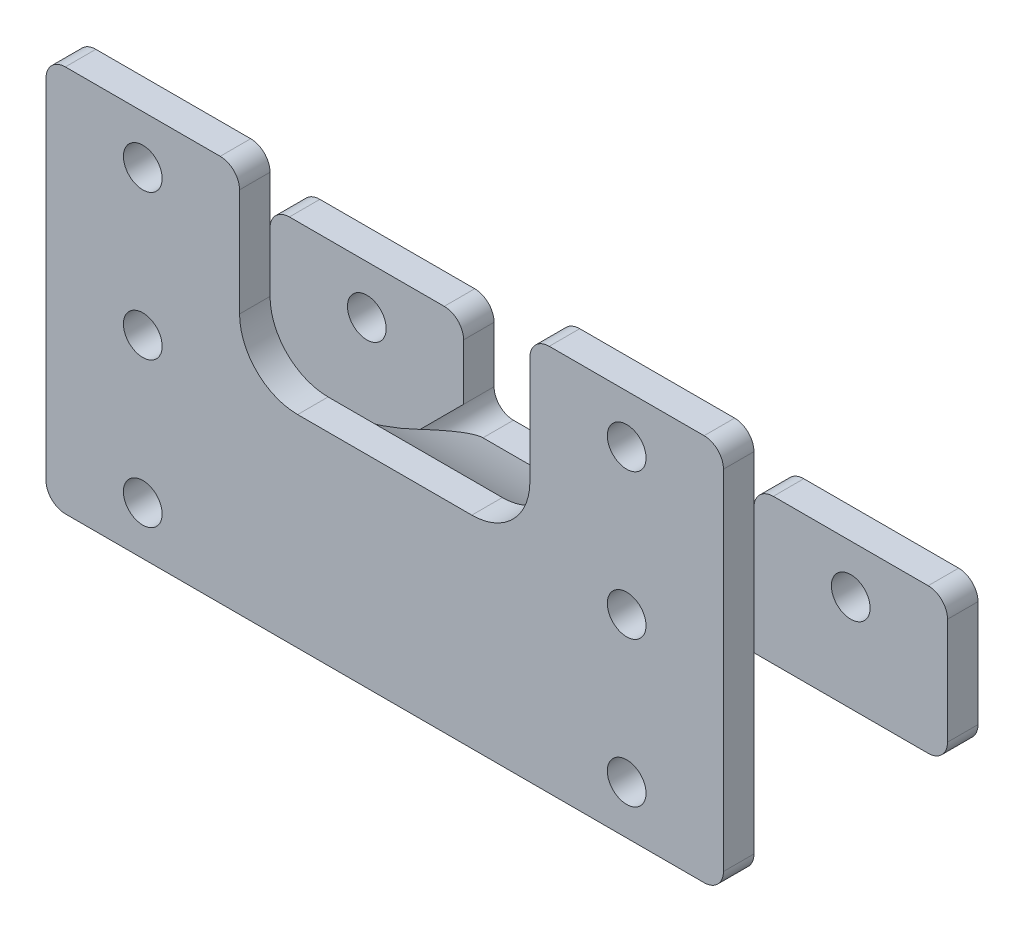
from build123d import *

# Parameters (mm, degrees)
SKETCH1_W             = 25.4
SKETCH1_H             = 50.8
SKETCH1_R             = 2.54
BOSS_EXTRUDE1_DEPTH   = 4
BOSS_EXTRUDE1_2_DEPTH = 4
SKETCH2_W             = 4
SKETCH2_H             = 26.531408834
BOSS_EXTRUDE2_DEPTH   = 38.1
SKETCH3_R             = 2.54
SKETCH3_W             = 19.05
SKETCH3_H             = 6.648533437
BOSS_EXTRUDE3_DEPTH   = 4
FILLET1_R             = 7.62
FILLET2_R             = 2.54


with BuildPart() as part:
    # Sketch1 → Boss-Extrude1 (new body)
    with BuildSketch(Plane.XY):
        with Locations((0, 25.4)):
            Rectangle(SKETCH1_W, SKETCH1_H)
        with Locations((0, 44.45)):
            Circle(SKETCH1_R, mode=Mode.SUBTRACT)
        with Locations((0, 25.4)):
            Circle(SKETCH1_R, mode=Mode.SUBTRACT)
        with Locations((0, 6.35)):
            Circle(SKETCH1_R, mode=Mode.SUBTRACT)
    extrude(amount=BOSS_EXTRUDE1_DEPTH)



with BuildPart() as body_2:
    # Sketch1 → Boss-Extrude1 2 (new body)
    with BuildSketch(Plane.XY):
        with Locations((63.5, 25.4)):
            Rectangle(SKETCH1_W, SKETCH1_H)
        with Locations((63.5, 25.4)):
            Circle(SKETCH1_R, mode=Mode.SUBTRACT)
        with Locations((63.5, 44.45)):
            Circle(SKETCH1_R, mode=Mode.SUBTRACT)
        with Locations((63.5, 6.35)):
            Circle(SKETCH1_R, mode=Mode.SUBTRACT)
    extrude(amount=BOSS_EXTRUDE1_2_DEPTH)


with BuildPart() as part_1:
    add(part.part)

    add(body_2.part)  # Boss-Extrude2 merges body 2
    # Sketch2 → Boss-Extrude2 (add)
    with BuildSketch(Plane.ZY.offset(-50.8)):
        with BuildLine():
            Line((0, 0), (0, 26.531408834))
            ThreePointArc((0, 26.531408834), (-11.179973196, 14.648165434), (-25.4, 6.648533437))
            Line((-25.4, 6.648533437), (-25.4, 0))
            Line((-25.4, 0), (0, 0))
        make_face()
        with Locations((2, 13.265704417)):
            Rectangle(SKETCH2_W, SKETCH2_H)
    extrude(amount=BOSS_EXTRUDE2_DEPTH)

    # Sketch3 → Boss-Extrude3 (add)
    # profile 1 of 3: a face of its own
    with BuildSketch(Plane(origin=(0, 0, -25.4), x_dir=(-1, 0, 0), z_dir=(0, 0, -1))):
        Polygon((-12.7, 6.648533437), (-12.7, 0), (12.7, 0), (12.7, 19.05), (-12.7, 19.05), align=None)
        with Locations(Location((0, 12.7, 0), (0, 0, 90))):
            Circle(SKETCH3_R, mode=Mode.SUBTRACT)
    # profile 2 of 3: a face of its own
    with BuildSketch(Plane(origin=(0, 0, -25.4), x_dir=(-1, 0, 0), z_dir=(0, 0, -1))):
        with Locations((-22.225, 3.324266719)):
            Rectangle(SKETCH3_W, SKETCH3_H)
    # profile 3 of 3: a face of its own
    with BuildSketch(Plane(origin=(0, 0, -25.4), x_dir=(-1, 0, 0), z_dir=(0, 0, -1))):
        Polygon((-76.2, 0), (-31.75, 0), (-31.75, 6.648533437), (-50.8, 6.648533437), (-50.8, 19.05), (-76.2, 19.05), align=None)
        with Locations(Location((-63.5, 12.7, 0), (0, 0, 90))):
            Circle(SKETCH3_R, mode=Mode.SUBTRACT)
    extrude(amount=BOSS_EXTRUDE3_DEPTH)

    # Fillet1
    # the kernel refuses this fillet: 7.62 mm, written as the material it adds along each edge
    with BuildSketch(Plane(origin=(12.7, 26.531408834, 4), x_dir=(0, 1, 0), z_dir=(0, 0, -1)), Plane(origin=(50.8, 26.531408834, 4), x_dir=(-1, 0, 0), z_dir=(0, 0, -1))) as fillet1_piece_1:
        with BuildLine():
            CenterArc((FILLET1_R, FILLET1_R), FILLET1_R, 180, 90)
            Line((0, FILLET1_R), (0, 0))
            Line((0, 0), (FILLET1_R, 0))
        make_face()
    extrude(amount=4)

    # Fillet2
    # the kernel refuses this fillet: 2.54 mm, written as the material it adds along each edge
    with BuildSketch(Plane(origin=(12.7, 6.648533437, -19.05), x_dir=(1, 0, 0), z_dir=(0, 0, -1))) as fillet2_piece_1:
        with BuildLine():
            CenterArc((FILLET2_R, -FILLET2_R), FILLET2_R, 90, 90)
            Line((0, -FILLET2_R), (0, 0))
            Line((0, 0), (FILLET2_R, 0))
        make_face()
    extrude(amount=10.35)
    with BuildSketch(Plane(origin=(50.8, 6.648533437, -19.05), x_dir=(-1, 0, 0), z_dir=(0, 0, -1))) as fillet2_piece_2:
        with BuildLine():
            CenterArc((FILLET2_R, FILLET2_R), FILLET2_R, 180, 90)
            Line((0, FILLET2_R), (0, 0))
            Line((0, 0), (FILLET2_R, 0))
        make_face()
    extrude(amount=10.35)
    # the kernel refuses this fillet: 2.54 mm, written as the material it takes off along each edge
    with BuildSketch(Plane(origin=(12.7, 50.8, -6.35), x_dir=(-1, 0, 0), z_dir=(0, 0, 1)), Plane(origin=(-12.7, 0, -6.35), x_dir=(1, 0, 0), z_dir=(0, 0, 1)), Plane(origin=(76.2, 0, -6.35), x_dir=(0, 1, 0), z_dir=(0, 0, 1)), Plane(origin=(76.2, 50.8, -6.35), x_dir=(-1, 0, 0), z_dir=(0, 0, 1)), Plane(origin=(-12.7, 19.05, -19.05), x_dir=(1, 0, 0), z_dir=(0, 0, -1)), Plane(origin=(12.7, 19.05, -19.05), x_dir=(0, -1, 0), z_dir=(0, 0, -1)), Plane(origin=(50.8, 19.05, -19.05), x_dir=(1, 0, 0), z_dir=(0, 0, -1)), Plane(origin=(76.2, 0, -19.05), x_dir=(-1, 0, 0), z_dir=(0, 0, -1))) as fillet2_2_piece_1:
        with BuildLine():
            CenterArc((FILLET2_R, FILLET2_R), FILLET2_R, 180, 90)
            Line((0, FILLET2_R), (0, 0))
            Line((0, 0), (FILLET2_R, 0))
        make_face()
    extrude(amount=16.7, mode=Mode.SUBTRACT)
    with BuildSketch(Plane(origin=(-12.7, 50.8, -6.35), x_dir=(1, 0, 0), z_dir=(0, 0, 1)), Plane(origin=(50.8, 50.8, -6.35), x_dir=(1, 0, 0), z_dir=(0, 0, 1)), Plane(origin=(-12.7, 0, -19.05), x_dir=(1, 0, 0), z_dir=(0, 0, -1)), Plane(origin=(76.2, 19.05, -19.05), x_dir=(-1, 0, 0), z_dir=(0, 0, -1))) as fillet2_2_piece_2:
        with BuildLine():
            CenterArc((FILLET2_R, -FILLET2_R), FILLET2_R, 90, 90)
            Line((0, -FILLET2_R), (0, 0))
            Line((0, 0), (FILLET2_R, 0))
        make_face()
    extrude(amount=16.7, mode=Mode.SUBTRACT)


solid = part_1.part
